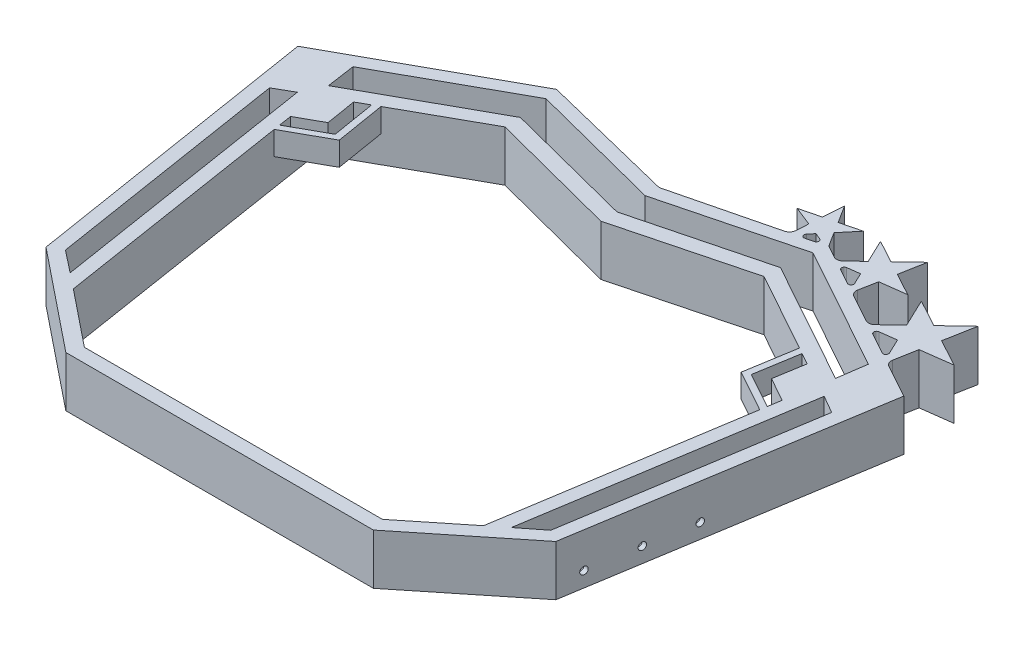
from build123d import *

# Parameters (mm, degrees)
EXTRUDE_1_DEPTH = 15
EXTRUDE_START   = 8
EXTRUDE_3_DEPTH = 7
EXTRUDE_4_DEPTH = 15
EXTRUDE_5_DEPTH = 15
EXTRUDE_6_DEPTH = 15
FILLET_1_R      = 2
FILLET_2_R      = 0.8
F_2_0MM_1_D     = 2.2
F_2_0MM_1_DEPTH = 1.5
F_2_0MM_1_TIP   = 0.660946681
F_2_0MM_2_D     = 2.2
F_2_0MM_2_DEPTH = 1.5
F_2_0MM_2_TIP   = 0.660946681


with BuildPart() as part:
    # 草图1 → 凸台-拉伸1 (new body)
    with BuildSketch(Plane(origin=(0, 0, 0), x_dir=(1, 0, 0), z_dir=(0, 1, 0))):
        Polygon((49.5194763, 27.3201645), (0, 0), (14.2759212, -89.0995664), (44.3217232, -113.2519378), (135.6782768, -113.2519378), (165.7240788, -89.0995664), (180, 0), (130.4805237, 27.3201645), (90, 17.2995935), align=None)
        Polygon((6.502592683, -14.920940874), (11.7659704, -11.9027565), (24.4692995, -92.1170773), (17.9120995, -86.965507524), align=None, mode=Mode.SUBTRACT)
        Polygon((51.5112815, 10), (90, 0), (128.4887185, 10), (152.140164487, -3.156709279), (153.941562556, -4.158782079), (157.3669305, -6.0642288), (164.466088374, -10.013313195), (163.0222846, -19.1574054), (162.41503493, -23.003320662), (162.112651759, -24.918414423), (150.9253582, -95.7712863), (134.2722611, -109.1590702), (45.7277389, -109.1590702), (29.0746418, -95.7712863), (17.887348241, -24.918414423), (17.58496507, -23.003320662), (16.9777154, -19.1574054), (15.533911626, -10.013313195), (22.6330695, -6.0642288), (26.058437444, -4.158782079), (27.859835513, -3.156709279), align=None, mode=Mode.SUBTRACT)
        Polygon((162.0879005, -86.965507524), (155.5307005, -92.1170773), (168.2340296, -11.9027565), (173.497407317, -14.920940874), align=None, mode=Mode.SUBTRACT)
        Polygon((50.326908, 23.3565545), (90, 13.1373278), (129.673092, 23.3565545), (166.5422291, 2.924677806), (165.312614852, -5.602660324), (128.635248263, 14.72294235), (90, 4.7710495), (51.364751737, 14.72294235), (14.687385148, -5.602660324), (13.4577709, 2.924677806), align=None, mode=Mode.SUBTRACT)
    extrude(amount=EXTRUDE_1_DEPTH)

    # 草图1<4> → 凸台-拉伸3 (add)
    with BuildSketch(Plane(origin=(0, 0, 0), x_dir=(1, 0, 0), z_dir=(0, 1, 0)).offset(EXTRUDE_START)):
        Polygon((164.466088374, -10.013313195), (163.0222846, -19.1574054), (155.8678549, -15.177574667), (157.3669305, -6.0642288), align=None)
        Polygon((153.941562556, -4.158782079), (152.140164487, -3.156709279), (149.6966334, -18.0116932), (162.112651759, -24.918414423), (162.41503493, -23.003320662), (151.8119905, -17.1051116), align=None)
        Polygon((22.6330695, -6.0642288), (15.533911626, -10.013313195), (16.9777154, -19.1574054), (24.1321451, -15.177574667), align=None)
        Polygon((30.3033666, -18.0116932), (27.859835513, -3.156709279), (26.058437444, -4.158782079), (28.1880095, -17.1051116), (17.58496507, -23.003320662), (17.887348241, -24.918414423), align=None)
    extrude(amount=EXTRUDE_3_DEPTH)

    # 草图3 → 凸台-拉伸4 (add)
    with BuildSketch(Plane(origin=(0, 0, 0), x_dir=(1, 0, 0), z_dir=(0, 1, 0))):
        Polygon((115.878940082, 32.456095876), (121.872227157, 33.965105872), (122.289100924, 40.131370332), (125.576282273, 34.897725339), (131.569569347, 36.406735336), (127.607872073, 31.663154849), (130.895053422, 26.429509857), (125.159408505, 28.73146088), (121.197711231, 23.987880393), (121.614584999, 30.154144853), align=None)
    extrude(amount=EXTRUDE_4_DEPTH)

    # 草图4 → 凸台-拉伸5 (add)
    with BuildSketch(Plane(origin=(0, 0, 0), x_dir=(1, 0, 0), z_dir=(0, 1, 0))):
        Polygon((168.625201424, 5.109151957), (158.192316311, 27.022904619), (179.513278304, 15.426602313), (155.448122239, 12.276060926), (173.065400703, 28.970046279), align=None)
        Polygon((173.065400703, 28.970046279), (166.336199119, 22.593511282), (171.369395495, 19.85599565), align=None)
        Polygon((179.513278304, 15.426602313), (171.369395495, 19.85599565), (170.321206632, 14.223202586), align=None)
        Polygon((170.321206632, 14.223202586), (164.640193911, 13.479460653), (168.625201424, 5.109151957), align=None)
        Polygon((164.640193911, 13.479460653), (162.177323823, 18.652595923), (155.448122239, 12.276060926), align=None)
        Polygon((166.336199119, 22.593511282), (158.192316311, 27.022904619), (162.177323823, 18.652595923), align=None)
    extrude(amount=EXTRUDE_5_DEPTH)

    # 草图5 → 凸台-拉伸6 (add)
    with BuildSketch(Plane(origin=(0, 0, 0), x_dir=(1, 0, 0), z_dir=(0, 1, 0))):
        Polygon((145.437967888, 18.068925838), (136.74389696, 36.330386388), (154.511365288, 26.666801134), (134.457068567, 24.041349978), (149.138133954, 37.953004439), align=None)
        Polygon((143.530465967, 32.639225275), (136.74389696, 36.330386388), (140.064736554, 29.355129142), align=None)
        Polygon((149.138133954, 37.953004439), (143.530465967, 32.639225275), (147.724796281, 30.357962248), align=None)
        Polygon((154.511365288, 26.666801134), (147.724796281, 30.357962248), (146.851305561, 25.663968028), align=None)
        Polygon((146.851305561, 25.663968028), (142.117128294, 25.044183084), (145.437967888, 18.068925838), align=None)
        Polygon((142.117128294, 25.044183084), (140.064736554, 29.355129142), (134.457068567, 24.041349978), align=None)
    extrude(amount=EXTRUDE_6_DEPTH)

    # 圆角1
    # the kernel refuses this fillet: 2 mm, written as the material it adds along each edge
    with BuildSketch(Plane(origin=(121.268833448, 15, -25.039897652), x_dir=(-0.9707016379334082, 0, 0.2402880149183444), z_dir=(0, -1, 0))) as fillet_1_piece_1:
        with BuildLine():
            CenterArc((FILLET_1_R * 0.72959801192, FILLET_1_R), FILLET_1_R, 197.771167986, 72.228832014)
            Line((-FILLET_1_R * 0.222685090293, FILLET_1_R * 0.69478385816), (-FILLET_1_R * 0.241730752337, FILLET_1_R * 0.688679535323))
            Line((-FILLET_1_R * 0.241730752337, FILLET_1_R * 0.688679535323), (-FILLET_1_R * 0.0145919602384, -FILLET_1_R * 0.02))
            Line((-FILLET_1_R * 0.0145919602384, -FILLET_1_R * 0.02), (FILLET_1_R * 0.72959801192, -FILLET_1_R * 0.02))
            Line((FILLET_1_R * 0.72959801192, -FILLET_1_R * 0.02), (FILLET_1_R * 0.72959801192, 0))
        make_face()
    extrude(amount=15)
    with BuildSketch(Plane(origin=(130.355139653, 0, -27.289126864), x_dir=(-0.5318771148973955, 0, -0.8468215482900885), z_dir=(0, 1, 0))) as fillet_1_piece_2:
        with BuildLine():
            CenterArc((0.649299153, -2), FILLET_1_R, 90, 20.172783533)
            Line((-0.040405567, -0.122686121), (-0.054199661, -0.085139844))
            ThreePointArc((-0.054199661, -0.085139844), (-0.058195374, -0.048830544), (-0.03799259, 0.012512517))
            Line((-0.03799259, 0.012512517), (0, 0.04))
            Line((0, 0.04), (0.649299153, 0.04))
            Line((0.649299153, 0.04), (0.649299153, 0))
        make_face()
    extrude(amount=15)
    with BuildSketch(Plane(origin=(168.822041947, 0, -6.166940275), x_dir=(0.18294627145075168, 0, -0.9831229128457274), z_dir=(0, 1, 0))) as fillet_1_piece_3:
        with BuildLine():
            CenterArc((FILLET_1_R * 0.721961366951, -FILLET_1_R), FILLET_1_R, 90, 71.655658553)
            Line((-FILLET_1_R * 0.227220826301, -FILLET_1_R * 0.685272873726), (-FILLET_1_R * 0.246204470166, -FILLET_1_R * 0.678978331201))
            Line((-FILLET_1_R * 0.246204470166, -FILLET_1_R * 0.678978331201), (-FILLET_1_R * 0.014439227339, FILLET_1_R * 0.02))
            Line((-FILLET_1_R * 0.014439227339, FILLET_1_R * 0.02), (FILLET_1_R * 0.721961366951, FILLET_1_R * 0.02))
            Line((FILLET_1_R * 0.721961366951, FILLET_1_R * 0.02), (FILLET_1_R * 0.721961366951, 0))
        make_face()
    extrude(amount=15)
    with BuildSketch(Plane(origin=(156.29474807, 0, -13.078316465), x_dir=(-0.8755846083755204, 0, -0.4830647923166069), z_dir=(0, 1, 0)), Plane(origin=(135.180696403, 0, -24.727053647), x_dir=(-0.8755846083755225, 0, -0.4830647923166032), z_dir=(0, 1, 0))) as fillet_1_piece_4:
        with BuildLine():
            CenterArc((FILLET_1_R * 0.731143736262, -FILLET_1_R), FILLET_1_R, 90, 72.344341447)
            Line((-FILLET_1_R * 0.221752752158, -FILLET_1_R * 0.696704298814), (-FILLET_1_R * 0.240810681926, -FILLET_1_R * 0.69063838479))
            Line((-FILLET_1_R * 0.240810681926, -FILLET_1_R * 0.69063838479), (-FILLET_1_R * 0.0146228747252, FILLET_1_R * 0.02))
            Line((-FILLET_1_R * 0.0146228747252, FILLET_1_R * 0.02), (FILLET_1_R * 0.731143736262, FILLET_1_R * 0.02))
            Line((FILLET_1_R * 0.731143736262, FILLET_1_R * 0.02), (FILLET_1_R * 0.731143736262, 0))
        make_face()
    extrude(amount=15)
    with BuildSketch(Plane(origin=(145.606582968, 0, -18.975035304), x_dir=(0.8755846083755114, 0, 0.4830647923166232), z_dir=(0, 1, 0))) as fillet_1_piece_5:
        with BuildLine():
            CenterArc((FILLET_1_R * 0.721961366951, FILLET_1_R), FILLET_1_R, 198.344341447, 71.655658553)
            Line((-FILLET_1_R * 0.227220826301, FILLET_1_R * 0.685272873726), (-FILLET_1_R * 0.246204470166, FILLET_1_R * 0.678978331201))
            Line((-FILLET_1_R * 0.246204470166, FILLET_1_R * 0.678978331201), (-FILLET_1_R * 0.014439227339, -FILLET_1_R * 0.02))
            Line((-FILLET_1_R * 0.014439227339, -FILLET_1_R * 0.02), (FILLET_1_R * 0.721961366951, -FILLET_1_R * 0.02))
            Line((FILLET_1_R * 0.721961366951, -FILLET_1_R * 0.02), (FILLET_1_R * 0.721961366951, 0))
        make_face()
    extrude(amount=15)

    # 圆角2
    fillet_2_edges = [part.edges().sort_by_distance(p)[0] for p in [
        (122.286771787, 7.5, -25.291878665),
        (129.364316192, 7.5, -27.043857882),
        (167.872084093, 7.5, -6.691037191),
        (157.30763239, 7.5, -12.519502675),
        (144.792841891, 7.5, -19.423980684),
        (136.046428654, 7.5, -24.249424454),
    ]]
    fillet(fillet_2_edges, radius=FILLET_2_R)

    # Ø2.0mm 暗销孔1
    with Locations(Plane(origin=(0, 0, 0), x_dir=(0.1582065041586212, 0, 0.9874060471973565), z_dir=(-0.9874060471973565, 0, 0.1582065041586212))):
        with Locations((82.844584748, 4.5), (52.844584748, 4.5), (67.844584748, 4.5)):
            Hole(F_2_0MM_1_D / 2, depth=F_2_0MM_1_DEPTH)
            with Locations((0, 0, -(F_2_0MM_1_DEPTH + F_2_0MM_1_TIP / 2))):  # 118° drill point
                Cone(0, F_2_0MM_1_D / 2, F_2_0MM_1_TIP, mode=Mode.SUBTRACT)

    # Ø2.0mm 暗销孔2
    with Locations(Plane(origin=(175.494726368, 0, 28.118530604), x_dir=(0.15820650415862106, 0, -0.9874060471973566), z_dir=(0.9874060471973566, 0, 0.15820650415862106))):
        with Locations((-54.462210035, 4.481040738), (-39.322424853, 4.512160057), (-24.310921517, 4.409353726)):
            Hole(F_2_0MM_2_D / 2, depth=F_2_0MM_2_DEPTH)
            with Locations((0, 0, -(F_2_0MM_2_DEPTH + F_2_0MM_2_TIP / 2))):  # 118° drill point
                Cone(0, F_2_0MM_2_D / 2, F_2_0MM_2_TIP, mode=Mode.SUBTRACT)


solid = part.part
